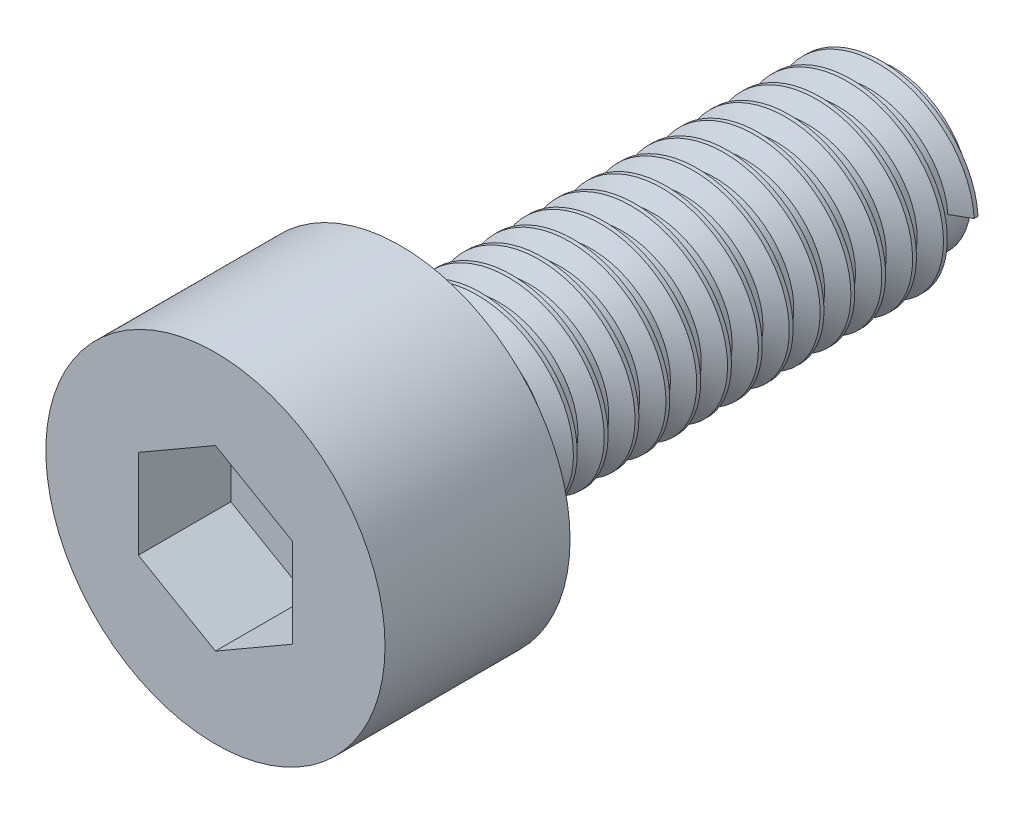
from build123d import *

# Parameters (mm, degrees)
SKETCH1_R           = 2.75
BOSS_EXTRUDE1_DEPTH = 3
SKETCH2_R           = 1.25
BOSS_EXTRUDE2_DEPTH = 8
CUT_EXTRUDE1_DEPTH  = 1.5
THREAD1_PITCH       = 0.5


with BuildPart() as part:
    # Sketch1 → Boss-Extrude1 (new body)
    with BuildSketch(Plane.XY):
        Circle(SKETCH1_R)
    extrude(amount=BOSS_EXTRUDE1_DEPTH)

    # Sketch2 → Boss-Extrude2 (add)
    with BuildSketch(Plane(origin=(0, 0, 0), x_dir=(-1, 0, 0), z_dir=(0, 0, -1))):
        Circle(SKETCH2_R)
    extrude(amount=BOSS_EXTRUDE2_DEPTH)

    # Sketch3 → Cut-Extrude1 (cut)
    with BuildSketch(Plane.XY.offset(3)):
        Polygon((0, 1.443375673), (-1.25, 0.721687836), (-1.25, -0.721687836), (0, -1.443375673), (1.25, -0.721687836), (1.25, 0.721687836), align=None)
    extrude(amount=-CUT_EXTRUDE1_DEPTH, mode=Mode.SUBTRACT)

    # Thread1: the profile of Thread Profile1 profile screwed along a right-hand helix of 16 turns, 6 arcs to a turn; built about Z, then put on its axis
    thread1_z = Axis((0, 0, 0), (0, 0, 1))
    thread1_corners = [(1.2497, 0, -0.000173205), (1.520632938, 0, 0.156249999), (1.520632937, 0, 0.218749999), (1.2497, 0, 0.375173204)]
    with BuildLine(mode=Mode.PRIVATE) as thread1_profile:
        Line(thread1_corners[0], thread1_corners[1])
        Line(thread1_corners[1], thread1_corners[2])
        Line(thread1_corners[2], thread1_corners[3])
        Line(thread1_corners[3], thread1_corners[0])
    thread1_cap = Face(thread1_profile.wire())
    thread1_turn_angles = [0, 30, 60, 90, 120, 150, 180, 210, 240, 270, 300, 330, 360]
    thread1_turn_weights = [1, 0.8660254037844387, 1, 0.8660254037844387, 1, 0.8660254037844387, 1, 0.8660254037844387, 1, 0.8660254037844387, 1, 0.8660254037844387, 1]
    thread1_turn_rails = [Edge.make_bspline([Vector(p[0], p[1], 0).rotate(thread1_z, thread1_turn_angles[k]) / thread1_turn_weights[k] + Vector(0, 0, p[2] + THREAD1_PITCH * thread1_turn_angles[k] / 360) for k in range(13)], [0, 0, 0, 1, 1, 2, 2, 3, 3, 4, 4, 5, 5, 6, 6, 6], 2, thread1_turn_weights) for p in thread1_corners]
    thread1_turn_sides = [Face.make_surface_from_curves(thread1_turn_rails[p[0]], thread1_turn_rails[p[1]]) for p in [(0, 1), (1, 2), (2, 3), (3, 0)]]
    thread1 = Plane(origin=(0, 0, -8), x_dir=(1, 0, 0), z_dir=(0, 0, 1)) * Solid(Shell([*[p.moved(Location((0, 0, THREAD1_PITCH * i))) for i in range(16) for p in thread1_turn_sides], thread1_cap, thread1_cap.rotate(thread1_z, 5760).moved(Location((0, 0, THREAD1_PITCH * 5760 / 360)))]))
    add(thread1)


solid = part.part
